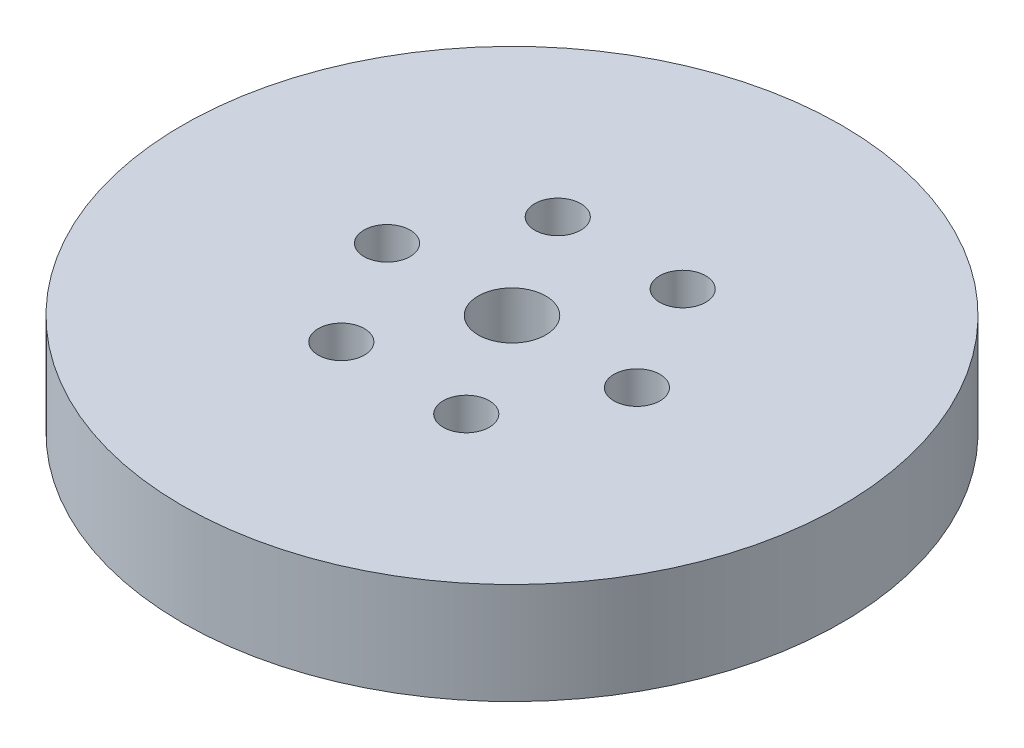
from build123d import *

# Parameters (mm, degrees)
SKETCH1_R           = 97.5
BOSS_EXTRUDE1_DEPTH = 30
SKETCH2_R           = 10
CUT_EXTRUDE1_DEPTH  = 142.111657917
SKETCH3_R           = 6.819096127
CUT_EXTRUDE2_DEPTH  = 20.141210853
CIRPATTERN1_COUNT   = 6


with BuildPart() as part:
    # Sketch1 → Boss-Extrude1 (new body)
    with BuildSketch(Plane(origin=(0, 0, 0), x_dir=(1, 0, 0), z_dir=(0, 1, 0))):
        Circle(SKETCH1_R)
    extrude(amount=BOSS_EXTRUDE1_DEPTH)

    # Sketch2 → Cut-Extrude1 (cut, through all)
    with BuildSketch(Plane(origin=(0, 0, 0), x_dir=(1, 0, 0), z_dir=(0, 1, 0))):
        Circle(SKETCH2_R)
    extrude(amount=CUT_EXTRUDE1_DEPTH, mode=Mode.SUBTRACT)

    # Sketch3 → Cut-Extrude2 (cut)
    with BuildSketch(Plane(origin=(0, 30, 0), x_dir=(1, 0, 0), z_dir=(0, 1, 0))):
        with Locations((-36.967875527, 0)):
            Circle(SKETCH3_R)
    cut_extrude2 = extrude(amount=-CUT_EXTRUDE2_DEPTH, mode=Mode.SUBTRACT)

    # CirPattern1: Cut-Extrude2 ×6 about axis
    cirpattern1_axis = Axis((0, 0, 0), (0, 1, 0))
    for i in range(1, CIRPATTERN1_COUNT):
        add(cut_extrude2.rotate(cirpattern1_axis, i * 360 / CIRPATTERN1_COUNT), mode=Mode.SUBTRACT)


solid = part.part
